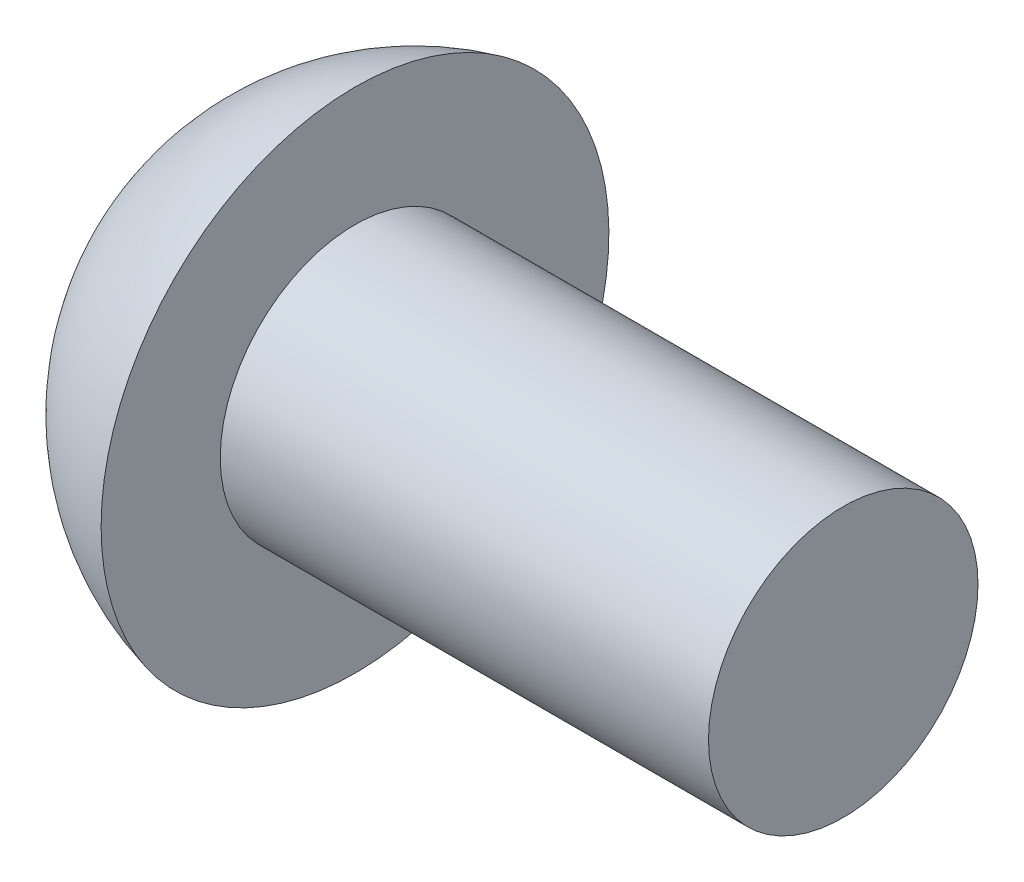
from build123d import *

# Parameters (mm, degrees)
CIRPATTERN1_COUNT = 2
CIRPATTERN1_ANGLE = 90


# Read off the part's stored shape, not the designer's step: ThreadSchematic
with BuildPart() as part:
    # ThreadSchematic outline → ThreadSchematic (revolve)
    with BuildSketch(Plane.YX):
        with BuildLine():
            Line((0, 8.9662), (0, 0))
            ThreePointArc((0, 0), (2.106401342, 0.733321609), (3.302000001, 2.616200001))
            Line((3.302000001, 2.616200001), (1.7526, 2.6162))
            Line((1.7526, 2.6162), (1.7526, 8.9662))
            Line((1.7526, 8.9662), (0, 8.9662))
        make_face()
    revolve(axis=Axis((0, 0, 0), (1, 0, 0)))

    # Sketch3 → Cross section 0
    with BuildSketch(Plane(origin=(0, 0, 0), x_dir=(0, 0, -1), z_dir=(1, 0, 0))):
        with BuildLine():
            Line((0.4318, -2.1463), (-0.4318, -2.1463))
            Line((-0.4318, -2.1463), (-0.4318, 2.1463))
            Line((-0.4318, 2.1463), (0.4318, 2.1463))
            Line((0.4318, 2.1463), (0.4318, -2.1463))
        make_face()
    # Sketch4 → Cross section 1
    with BuildSketch(Plane(origin=(2.4384, 0, 0), x_dir=(0, 0, -1), z_dir=(1, 0, 0))):
        with BuildLine():
            Line((0.2159, -0.2159), (-0.2159, -0.2159))
            Line((-0.2159, -0.2159), (-0.2159, 0.2159))
            Line((-0.2159, 0.2159), (0.2159, 0.2159))
            Line((0.2159, 0.2159), (0.2159, -0.2159))
        make_face()
    cross = loft(mode=Mode.SUBTRACT)

    # CirPattern1: Cross ×2 about axis
    cirpattern1_axis = Axis((0, 0, 0), (1, 0, 0))
    for i in range(1, CIRPATTERN1_COUNT):
        add(cross.rotate(cirpattern1_axis, i * CIRPATTERN1_ANGLE / (CIRPATTERN1_COUNT - 1)), mode=Mode.SUBTRACT)


solid = part.part
